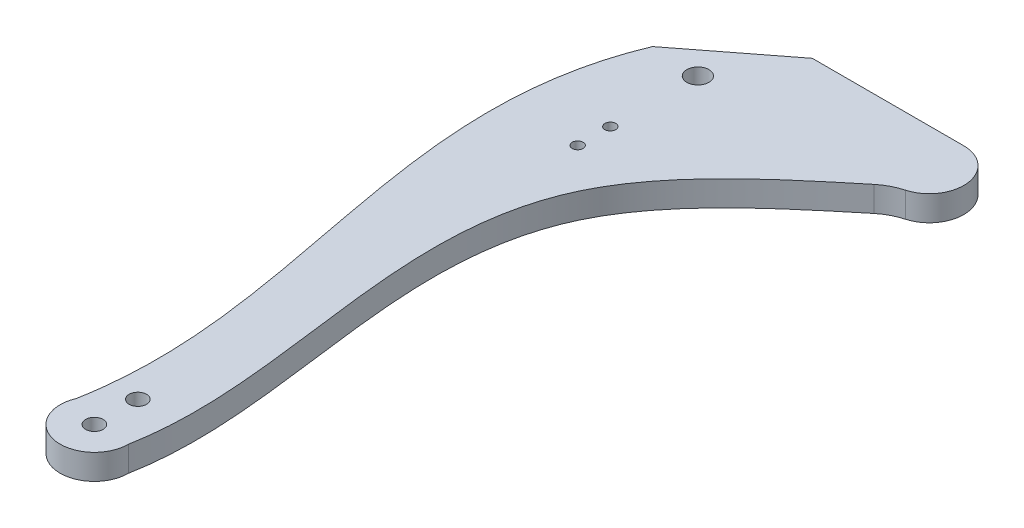
from build123d import *

# Parameters (mm, degrees)
SKETCH1_R           = 1.975
SKETCH1_R_2         = 1.554999938
SKETCH1_R_3         = 0.97
BOSS_EXTRUDE1_DEPTH = 4.5


with BuildPart() as part:
    # Sketch1 → Boss-Extrude1 (new body)
    with BuildSketch(Plane(origin=(0, 0, 0), x_dir=(1, 0, 0), z_dir=(0, 1, 0))):
        with BuildLine():
            Line((-16.144899663, 8.454003274), (10.877745108, 8.454003274))
            ThreePointArc((10.877745108, 8.454003274), (16.961539544, 3.139522495), (12.51277209, -3.603231306))
            ThreePointArc((12.51277209, -3.603231306), (10.56783567, -4.367093581), (8.824099884, -5.518461795))
            add(Edge.make_bspline(
                [(8.824099884, -5.518461795), (4.932532744, -8.718832913), (-4.696045283, -16.58586855), (-31.489086781, -46.943790059), (-12.894682963, -87.326546642), (-17.517744483, -112.138995974)],
                knots=[0.023478108, 0.023478108, 0.023478108, 0.023478108, 0.154944007, 0.330832674, 1, 1, 1, 1], degree=3))
            ThreePointArc((-17.517744483, -112.138995974), (-24.835663445, -118.119615453), (-29.239494185, -109.757437382))
            add(Edge.make_bspline(
                [(-32.217521916, -3.987452131), (-42.206514906, -27.827820505), (-29.561370115, -63.982250345), (-27.390169054, -99.665041987), (-29.239494185, -109.757437382)],
                knots=[0, 0, 0, 0, 0.696305279, 0.977824201, 0.977824201, 0.977824201, 0.977824201], degree=3))
            Line((-32.217521916, -3.987452131), (-16.144899663, 8.454003274))
        make_face()
        with Locations((-23.620555115, -4.478995902)):
            Circle(SKETCH1_R, mode=Mode.SUBTRACT)
        with Locations((-23.620555115, -112.138995974)):
            Circle(SKETCH1_R_2, mode=Mode.SUBTRACT)
        with Locations((-23.620555115, -104.378996)):
            Circle(SKETCH1_R_2, mode=Mode.SUBTRACT)
        with Locations((-23.620555115, -25.918995902)):
            Circle(SKETCH1_R_3, mode=Mode.SUBTRACT)
        with Locations((-23.620555115, -20.098995902)):
            Circle(SKETCH1_R_3, mode=Mode.SUBTRACT)
    extrude(amount=BOSS_EXTRUDE1_DEPTH)


solid = part.part
